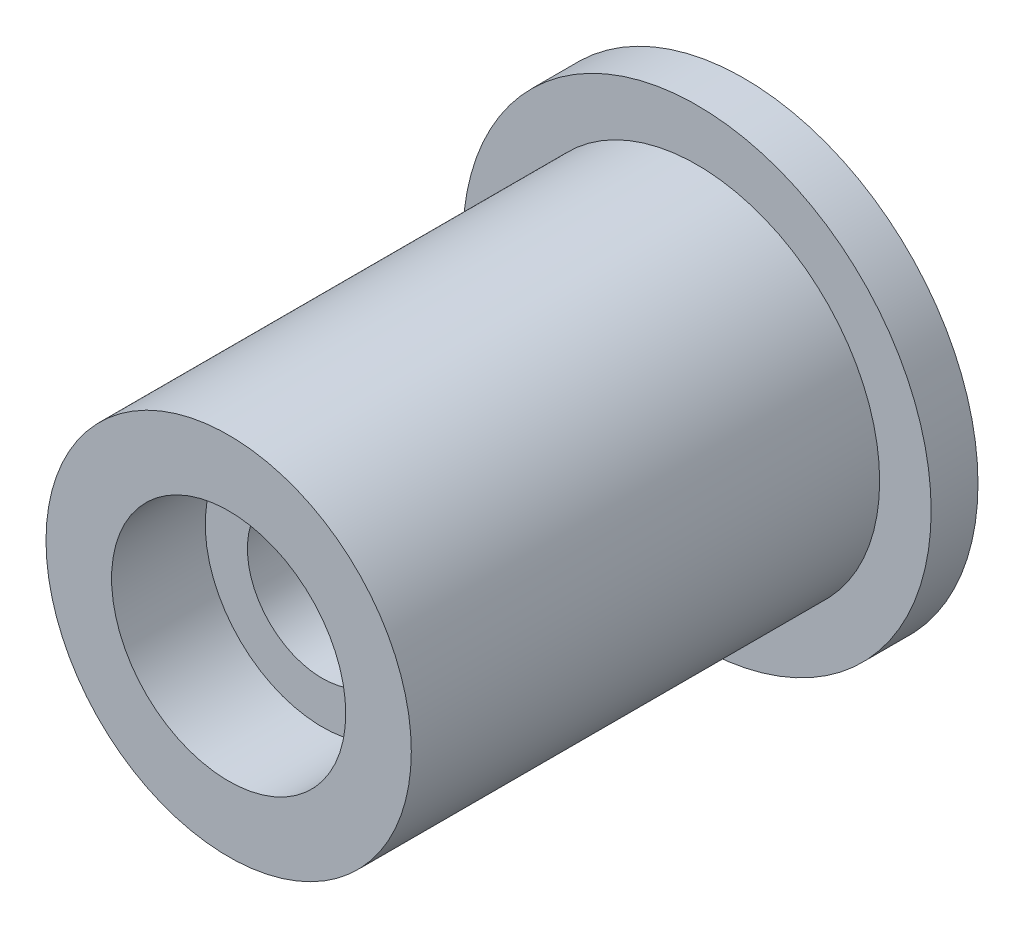
from build123d import *

# Parameters (mm, degrees)
SKETCH1_R           = 5
SKETCH1_R_2         = 1.6
BOSS_EXTRUDE1_DEPTH = 1
SKETCH1_3_R         = 3.9
SKETCH1_3_R_2       = 2.5
BOSS_EXTRUDE2_DEPTH = 10
SKETCH1_4_R         = 2.5
SKETCH1_4_R_2       = 1.6
BOSS_EXTRUDE3_DEPTH = 8


with BuildPart() as part:
    # Sketch1 → Boss-Extrude1 (new body)
    with BuildSketch(Plane.XY):
        Circle(SKETCH1_R)
        Circle(SKETCH1_R_2, mode=Mode.SUBTRACT)
    extrude(amount=-BOSS_EXTRUDE1_DEPTH)

    # Sketch1<3> → Boss-Extrude2 (add)
    with BuildSketch(Plane.XY):
        Circle(SKETCH1_3_R)
        Circle(SKETCH1_3_R_2, mode=Mode.SUBTRACT)
    extrude(amount=BOSS_EXTRUDE2_DEPTH)

    # Sketch1<4> → Boss-Extrude3 (add)
    with BuildSketch(Plane.XY):
        Circle(SKETCH1_4_R)
        Circle(SKETCH1_4_R_2, mode=Mode.SUBTRACT)
    extrude(amount=BOSS_EXTRUDE3_DEPTH)


solid = part.part
